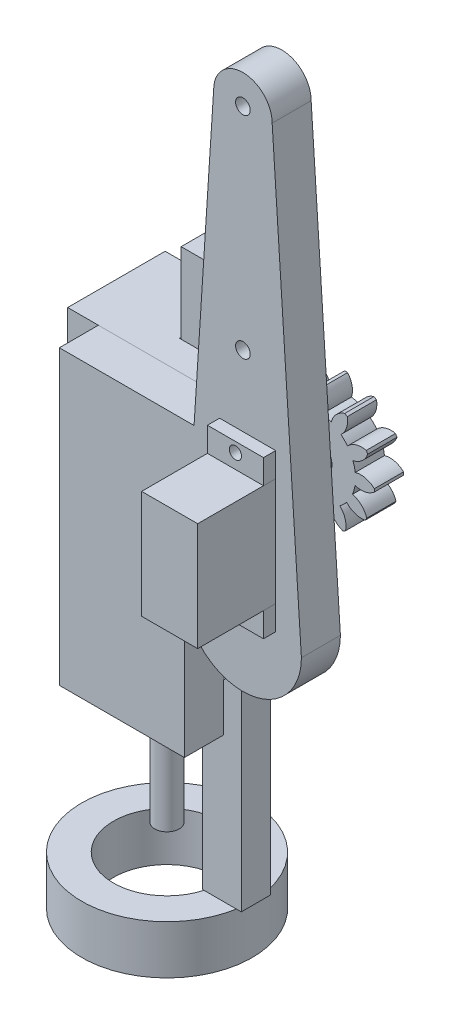
from build123d import *

# Parameters (mm, degrees)
SKETCH2_R                     = 1.5
BOSS_EXTRUDE1_DEPTH           = 8
CUT_EXTRUDE1_DEPTH            = 78.916763231
CUT_EXTRUDE1_DEPTH_BACK       = 10
SKETCH3_R                     = 2.25
CUT_EXTRUDE2_DEPTH            = 78.916763231
CUT_EXTRUDE2_DEPTH_BACK       = 1
SKETCH3_3_R                   = 1.25
SKETCH3_3_W                   = 11.5
SKETCH3_3_H                   = 5
SKETCH4_W                     = 11.5
SKETCH4_H                     = 22.2
BOSS_EXTRUDE3_DEPTH           = 17
SKETCH3_6_R                   = 1.25
BOSS_EXTRUDE4_DEPTH           = 2.5
SKETCH3_6_W                   = 11.5
SKETCH3_6_H                   = 5
BOSS_EXTRUDE4_2_DEPTH         = 2.5
SKETCH3_9_W                   = 11.5
SKETCH3_9_H                   = 22.2
BOSS_EXTRUDE7_DEPTH           = 4
SKETCH3_13_R                  = 2.25
BOSS_EXTRUDE10_DEPTH          = 9
SKETCH3_14_R                  = 2.25
BOSS_EXTRUDE12_DEPTH          = 12
SKETCH9_R                     = 3.3
SKETCH9_R_2                   = 2.3
EXTRUDE_THIN1_DEPTH           = 4
BODY_MOVE_COPY2_START         = -8
BODY_MOVE_COPY2_OUTLINE_R     = 3.3
BODY_MOVE_COPY2_OUTLINE_R_2   = 2.3
BODY_MOVE_COPY2_DEPTH         = 2
BODY_MOVE_COPY2_START_2       = -4
BODY_MOVE_COPY2_2_OUTLINE_R   = 3.3
BODY_MOVE_COPY2_2_OUTLINE_R_2 = 2.3
BODY_MOVE_COPY2_2_DEPTH       = 2
BOSS_EXTRUDE16_DEPTH          = 6
SKETCH26_W                    = 31.957276716
SKETCH26_H                    = 60
BOSS_EXTRUDE19_DEPTH          = 20
SKETCH28_W                    = 15
SKETCH28_H                    = 6
CUT_EXTRUDE5_DEPTH            = 85.244505145
CUT_EXTRUDE_THIN1_DEPTH       = 92.962691604
CUT_EXTRUDE_THIN1_DEPTH_BACK  = 20
SKETCH30_W                    = 31.957276716
SKETCH30_H                    = 10
BOSS_EXTRUDE20_DEPTH          = 6
SKETCH31_R                    = 2.5
BOSS_EXTRUDE21_DEPTH          = 40
BOSS_EXTRUDE22_DEPTH          = 6
SKETCH32_R                    = 17.5
SKETCH32_R_2                  = 11
BOSS_EXTRUDE23_DEPTH          = 10


# Read off the part's stored shape, not the designer's step: Body-Move/Copy2, Boss-Extrude20
with BuildPart() as part:
    # Sketch2 → Boss-Extrude1 (new body)
    with BuildSketch(Plane.XY):
        with BuildLine():
            Line((6, 61.74137931), (12, -30.25862069))
            ThreePointArc((12, -30.25862069), (0, -42.25862069), (-12, -30.25862069))
            Line((-12, -30.25862069), (-12, -60))
            Line((-12, -60), (-37.658033957, -60))
            Line((-37.658033957, -60), (-37.658033957, 0))
            Line((-37.658033957, 0), (-10.026611694, 0))
            Line((-10.026611694, 0), (-6, 61.74137931))
            ThreePointArc((-6, 61.74137931), (0, 67.74137931), (6, 61.74137931))
        make_face()
        with Locations((0, 61.74137931)):
            Circle(SKETCH2_R, mode=Mode.SUBTRACT)
        with Locations((0, 18.44137931)):
            Circle(SKETCH2_R, mode=Mode.SUBTRACT)
    extrude(amount=BOSS_EXTRUDE1_DEPTH)

    # Sketch3 → Cut-Extrude1 (cut, two sides: drawn at the far end of the back side and taken through both)
    # profile 1 of 5: a face of its own
    with BuildSketch(Plane.XY.offset(8).offset(-CUT_EXTRUDE1_DEPTH_BACK)):
        with BuildLine():
            Line((6.718793033, -23.282111217), (6.718793033, -6.832111217))
            ThreePointArc((6.718793033, -6.832111217), (5.674332938, -10.13671319), (2.920395049, -12.240784767))
            ThreePointArc((2.920395049, -12.240784767), (0.968793033, -14.871331018), (-0.982808983, -12.240784767))
            ThreePointArc((-0.982808983, -12.240784767), (-3.736746872, -10.13671319), (-4.781206967, -6.832111217))
            Line((-4.781206967, -6.832111217), (-4.781206967, -23.282111217))
            Line((-4.781206967, -23.282111217), (6.718793033, -23.282111217))
        make_face()
    # profile 2 of 5: a face of its own
    with BuildSketch(Plane.XY.offset(8).offset(-CUT_EXTRUDE1_DEPTH_BACK)):
        with BuildLine():
            ThreePointArc((2.920395049, -12.240784767), (0.968793033, -1.082111217), (-0.982808983, -12.240784767))
            ThreePointArc((-0.982808983, -12.240784767), (0.968793033, -14.871331018), (2.920395049, -12.240784767))
        make_face()
        with Locations((0.968793033, -6.832111217)):
            Circle(SKETCH3_R, mode=Mode.SUBTRACT)
    # profile 3 of 5: a face of its own
    with BuildSketch(Plane.XY.offset(8).offset(-CUT_EXTRUDE1_DEPTH_BACK)):
        with Locations((0.968793033, -6.832111217)):
            Circle(SKETCH3_R)
    # profile 4 of 5: a face of its own
    with BuildSketch(Plane.XY.offset(8).offset(-CUT_EXTRUDE1_DEPTH_BACK)):
        with BuildLine():
            Line((6.718793033, -1.082111217), (0.968793033, -1.082111217))
            ThreePointArc((0.968793033, -1.082111217), (5.034657025, -2.766247225), (6.718793033, -6.832111217))
            Line((6.718793033, -6.832111217), (6.718793033, -1.082111217))
        make_face()
    # profile 5 of 5: a face of its own
    with BuildSketch(Plane.XY.offset(8).offset(-CUT_EXTRUDE1_DEPTH_BACK)):
        with BuildLine():
            ThreePointArc((-4.781206967, -6.832111217), (-3.097070959, -2.766247225), (0.968793033, -1.082111217))
            Line((0.968793033, -1.082111217), (-4.781206967, -1.082111217))
            Line((-4.781206967, -1.082111217), (-4.781206967, -6.832111217))
        make_face()
    extrude(amount=CUT_EXTRUDE1_DEPTH + CUT_EXTRUDE1_DEPTH_BACK, mode=Mode.SUBTRACT)

    # Sketch3<3> → Cut-Extrude2 (cut, two sides: drawn at the far end of the back side and taken through both)
    # profile 1 of 4: a face of its own
    with BuildSketch(Plane.XY.offset(8).offset(-CUT_EXTRUDE2_DEPTH_BACK)):
        Polygon((-4.781206967, -1.082111217), (0.968793033, -1.082111217), (6.718793033, -1.082111217), (6.718793033, 3.917888783), (-4.781206967, 3.917888783), align=None)
        with Locations((0.968793033, 1.917888783)):
            Circle(SKETCH3_3_R, mode=Mode.SUBTRACT)
    # profile 2 of 4: a face of its own
    with BuildSketch(Plane.XY.offset(8).offset(-CUT_EXTRUDE2_DEPTH_BACK)):
        with Locations((0.968793033, 1.917888783)):
            Circle(SKETCH3_3_R)
    # profile 3 of 4: a face of its own
    with BuildSketch(Plane.XY.offset(8).offset(-CUT_EXTRUDE2_DEPTH_BACK)):
        with Locations((0.968793033, -25.782111217)):
            Rectangle(SKETCH3_3_W, SKETCH3_3_H)
        with Locations((0.968793033, -26.282111217)):
            Circle(SKETCH3_3_R, mode=Mode.SUBTRACT)
    # profile 4 of 4: a face of its own
    with BuildSketch(Plane.XY.offset(8).offset(-CUT_EXTRUDE2_DEPTH_BACK)):
        with Locations((0.968793033, -26.282111217)):
            Circle(SKETCH3_3_R)
    extrude(amount=CUT_EXTRUDE2_DEPTH + CUT_EXTRUDE2_DEPTH_BACK, mode=Mode.SUBTRACT)


with BuildPart() as body_2:
    # Sketch4 → Boss-Extrude3 (new body)
    with BuildSketch(Plane.XY.offset(7)):
        with Locations((0.968793033, -12.182111217)):
            Rectangle(SKETCH4_W, SKETCH4_H)
    extrude(amount=BOSS_EXTRUDE3_DEPTH)


with BuildPart() as body_3:
    # Sketch3<6> → Boss-Extrude4 (new body)
    with BuildSketch(Plane.XY.offset(8)):
        Polygon((-4.781206967, -1.082111217), (0.968793033, -1.082111217), (6.718793033, -1.082111217), (6.718793033, 3.917888783), (-4.781206967, 3.917888783), align=None)
        with Locations((0.968793033, 1.917888783)):
            Circle(SKETCH3_6_R, mode=Mode.SUBTRACT)
    extrude(amount=BOSS_EXTRUDE4_DEPTH)


with BuildPart() as body_4:
    # Sketch3<6> → Boss-Extrude4 2 (new body)
    with BuildSketch(Plane.XY.offset(8)):
        with Locations((0.968793033, -25.782111217)):
            Rectangle(SKETCH3_6_W, SKETCH3_6_H)
        with Locations((0.968793033, -26.282111217)):
            Circle(SKETCH3_6_R, mode=Mode.SUBTRACT)
    extrude(amount=BOSS_EXTRUDE4_2_DEPTH)


with BuildPart() as body_5:
    # Sketch3<9> → Boss-Extrude7 (new body)
    with BuildSketch(Plane.XY.offset(8)):
        with Locations((0.968793033, -12.182111217)):
            Rectangle(SKETCH3_9_W, SKETCH3_9_H)
    extrude(amount=-BOSS_EXTRUDE7_DEPTH)


with BuildPart() as body_6:
    # Sketch3<13> → Boss-Extrude10 (new body)
    with BuildSketch(Plane.XY.offset(8)):
        with BuildLine():
            ThreePointArc((2.920395049, -12.240784767), (0.968793033, -1.082111217), (-0.982808983, -12.240784767))
            ThreePointArc((-0.982808983, -12.240784767), (0.968793033, -14.871331018), (2.920395049, -12.240784767))
        make_face()
        with Locations((0.968793033, -6.832111217)):
            Circle(SKETCH3_13_R, mode=Mode.SUBTRACT)
    extrude(amount=-BOSS_EXTRUDE10_DEPTH)


with BuildPart() as body_7:
    # Sketch3<14> → Boss-Extrude12 (new body)
    with BuildSketch(Plane.XY.offset(8)):
        with Locations((0.968793033, -6.832111217)):
            Circle(SKETCH3_14_R)
    extrude(amount=-BOSS_EXTRUDE12_DEPTH)


with BuildPart() as body_8:
    # Sketch9 → Extrude-Thin1 (new body)
    with BuildSketch(Plane(origin=(0, 0, -4), x_dir=(-1, 0, 0), z_dir=(0, 0, -1))):
        with Locations((-0.968793033, -6.832111217)):
            Circle(SKETCH9_R)
        with Locations((-0.968793033, -6.832111217)):
            Circle(SKETCH9_R_2, mode=Mode.SUBTRACT)
    extrude(amount=EXTRUDE_THIN1_DEPTH)

    # Body-Move/Copy2 outline → Body-Move/Copy2 (cut)
    with BuildSketch(Plane.XY.offset(BODY_MOVE_COPY2_START)):
        with Locations((0.968793033, -6.832111217)):
            Circle(BODY_MOVE_COPY2_OUTLINE_R)
        with Locations((0.968793033, -6.832111217)):
            Circle(BODY_MOVE_COPY2_OUTLINE_R_2, mode=Mode.SUBTRACT)
    extrude(amount=BODY_MOVE_COPY2_DEPTH, mode=Mode.SUBTRACT)

    # Body-Move_Copy2 2 outline → Body-Move_Copy2 2 (add)
    with BuildSketch(Plane.XY.offset(BODY_MOVE_COPY2_START_2)):
        with Locations((0.968793033, -6.832111217)):
            Circle(BODY_MOVE_COPY2_2_OUTLINE_R)
        with Locations((0.968793033, -6.832111217)):
            Circle(BODY_MOVE_COPY2_2_OUTLINE_R_2, mode=Mode.SUBTRACT)
    extrude(amount=BODY_MOVE_COPY2_2_DEPTH)

    # Sketch20 → Boss-Extrude16 (add)
    with BuildSketch(Plane(origin=(0, 0, -6), x_dir=(-1, 0, 0), z_dir=(0, 0, -1))):
        with BuildLine():
            ThreePointArc((-11.608830214, -1.282624278), (-10.444163041, -3.009989163), (-8.582644253, -3.945396491))
            ThreePointArc((-8.582644253, -3.945396491), (-8.869637263, -4.862209504), (-9.046655113, -5.806442404))
            ThreePointArc((-9.046655113, -5.806442404), (-11.129425787, -5.758427918), (-12.968714556, -6.736822467))
            ThreePointArc((-12.968714556, -6.736822467), (-12.967265179, -7.041545327), (-12.958078998, -7.34613314))
            ThreePointArc((-12.958078998, -7.34613314), (-11.085765197, -8.259741426), (-9.005938973, -8.139068541))
            ThreePointArc((-9.005938973, -8.139068541), (-8.796075704, -9.076548406), (-8.47726121, -9.982787009))
            ThreePointArc((-8.47726121, -9.982787009), (-10.305000766, -10.982590581), (-11.40867429, -12.7495495))
            ThreePointArc((-11.40867429, -12.7495495), (-11.255057663, -13.01272255), (-11.09480829, -13.271910243))
            ThreePointArc((-11.09480829, -13.271910243), (-9.016532832, -13.126961327), (-7.275686929, -11.982542431))
            ThreePointArc((-7.275686929, -11.982542431), (-6.625200074, -12.689492175), (-5.895979321, -13.31491058))
            ThreePointArc((-5.895979321, -13.31491058), (-6.978946422, -15.094635651), (-7.051276272, -17.176703724))
            ThreePointArc((-7.051276272, -17.176703724), (-6.786653846, -17.327809957), (-6.518279972, -17.472148397))
            ThreePointArc((-6.518279972, -17.472148397), (-4.790915087, -16.307481225), (-3.855507758, -14.445962437))
            ThreePointArc((-3.855507758, -14.445962437), (-2.938694746, -14.732955447), (-1.994461846, -14.909973297))
            ThreePointArc((-1.994461846, -14.909973297), (-2.042476332, -16.99274397), (-1.064081783, -18.832032739))
            ThreePointArc((-1.064081783, -18.832032739), (-0.759358923, -18.830583363), (-0.454771109, -18.821397182))
            ThreePointArc((-0.454771109, -18.821397182), (0.458837176, -16.949083381), (0.338164291, -14.869257156))
            ThreePointArc((0.338164291, -14.869257156), (1.275644156, -14.659393887), (2.181882759, -14.340579393))
            ThreePointArc((2.181882759, -14.340579393), (3.181686332, -16.168318949), (4.94864525, -17.271992473))
            ThreePointArc((4.94864525, -17.271992473), (5.2118183, -17.118375847), (5.471005993, -16.958126474))
            ThreePointArc((5.471005993, -16.958126474), (5.326057077, -14.879851016), (4.181638181, -13.139005112))
            ThreePointArc((4.181638181, -13.139005112), (4.888587925, -12.488518258), (5.51400633, -11.759297505))
            ThreePointArc((5.51400633, -11.759297505), (7.293731401, -12.842264606), (9.375799474, -12.914594456))
            ThreePointArc((9.375799474, -12.914594456), (9.526905707, -12.64997203), (9.671244148, -12.381598155))
            ThreePointArc((9.671244148, -12.381598155), (8.506576975, -10.654233271), (6.645058187, -9.718825942))
            ThreePointArc((6.645058187, -9.718825942), (6.932051197, -8.802012929), (7.109069047, -7.85778003))
            ThreePointArc((7.109069047, -7.85778003), (9.191839721, -7.905794515), (11.031128489, -6.927399966))
            ThreePointArc((11.031128489, -6.927399966), (11.029679113, -6.622677106), (11.020492932, -6.318089293))
            ThreePointArc((11.020492932, -6.318089293), (9.148179131, -5.404481008), (7.068352907, -5.525153892))
            ThreePointArc((7.068352907, -5.525153892), (6.858489638, -4.587674028), (6.539675143, -3.681435424))
            ThreePointArc((6.539675143, -3.681435424), (8.367414699, -2.681631852), (9.471088223, -0.914672933))
            ThreePointArc((9.471088223, -0.914672933), (9.317471597, -0.651499884), (9.157222224, -0.39231219))
            ThreePointArc((9.157222224, -0.39231219), (7.078946766, -0.537261107), (5.338100862, -1.681680002))
            ThreePointArc((5.338100862, -1.681680002), (4.687614008, -0.974730258), (3.958393255, -0.349311853))
            ThreePointArc((3.958393255, -0.349311853), (5.041360356, 1.430413217), (5.113690206, 3.51248129))
            ThreePointArc((5.113690206, 3.51248129), (4.84906778, 3.663587524), (4.580693905, 3.807925964))
            ThreePointArc((4.580693905, 3.807925964), (2.853329021, 2.643258791), (1.917921692, 0.781740003))
            ThreePointArc((1.917921692, 0.781740003), (1.00110868, 1.068733013), (0.05687578, 1.245750864))
            ThreePointArc((0.05687578, 1.245750864), (0.104890265, 3.328521537), (-0.873504284, 5.167810306))
            ThreePointArc((-0.873504284, 5.167810306), (-1.178227143, 5.16636093), (-1.482814957, 5.157174748))
            ThreePointArc((-1.482814957, 5.157174748), (-2.396423242, 3.284860947), (-2.275750358, 1.205034723))
            ThreePointArc((-2.275750358, 1.205034723), (-3.213230222, 0.995171454), (-4.119468825, 0.67635696))
            ThreePointArc((-4.119468825, 0.67635696), (-5.119272398, 2.504096516), (-6.886231317, 3.60777004))
            ThreePointArc((-6.886231317, 3.60777004), (-7.149404366, 3.454153413), (-7.40859206, 3.29390404))
            ThreePointArc((-7.40859206, 3.29390404), (-7.263643143, 1.215628582), (-6.119224248, -0.525217321))
            ThreePointArc((-6.119224248, -0.525217321), (-6.826173991, -1.175704176), (-7.451592396, -1.904924928))
            ThreePointArc((-7.451592396, -1.904924928), (-9.231317467, -0.821957828), (-11.31338554, -0.749627978))
            ThreePointArc((-11.31338554, -0.749627978), (-11.464491773, -1.014250404), (-11.608830214, -1.282624278))
        make_face()
    extrude(amount=BOSS_EXTRUDE16_DEPTH)


with BuildPart() as body_9:
    # Sketch26 → Boss-Extrude19 (new body)
    with BuildSketch(Plane(origin=(0, 0, 0), x_dir=(-1, 0, 0), z_dir=(0, 0, -1))):
        with Locations((27.978638358, -30)):
            Rectangle(SKETCH26_W, SKETCH26_H)
    extrude(amount=BOSS_EXTRUDE19_DEPTH)

    # Sketch28 → Cut-Extrude5 (cut, through all)
    with BuildSketch(Plane(origin=(0, 0, 0), x_dir=(1, 0, 0), z_dir=(0, 1, 0))):
        with Locations((-19.5, 9)):
            Rectangle(SKETCH28_W, SKETCH28_H)
    extrude(amount=-CUT_EXTRUDE5_DEPTH, mode=Mode.SUBTRACT)

    # Sketch30 → Cut-Extrude-Thin1 (cut, two sides: drawn at the far end of the back side and taken through both)
    with BuildSketch(Plane(origin=(0, 0, -20), x_dir=(-1, 0, 0), z_dir=(0, 0, -1)).offset(-CUT_EXTRUDE_THIN1_DEPTH_BACK)):
        with Locations((27.978638358, -55.222248526)):
            Rectangle(SKETCH30_W, SKETCH30_H)
    extrude(amount=CUT_EXTRUDE_THIN1_DEPTH + CUT_EXTRUDE_THIN1_DEPTH_BACK, mode=Mode.SUBTRACT)


with BuildPart() as body_10:
    # Boss-Extrude20 outline → Boss-Extrude20 (new body)
    with BuildSketch(Plane(origin=(0, 0, -6), x_dir=(-1, 0, 0), z_dir=(0, 0, -1))):
        Polygon((13.174426709, -55.582797385), (14.33357684, -55.582797385), (14.33357684, -95.582797385), (22.33357684, -95.582797385), (22.33357684, -60), (26.674426709, -60), (26.674426709, 16.457265735), (13.174426709, 16.457265735), (13.174426709, 8.880955175), (8.071228846, 7.223200766), (8.071228846, 5.855664244), (13.174426709, 4.197909835), (13.174426709, 3.580955175), (8.071228846, 1.923200766), (8.071228846, 0.555664244), (12, -0.720582117), (12, 0), (13.174426709, 0), (13.174426709, -1.719044825), (8.071228846, -3.376799234), (8.071228846, -4.744335756), (13.174426709, -6.402090165), (13.174426709, -7.019044825), (8.071228846, -8.676799234), (8.071228846, -10.044335756), (13.174426709, -11.702090165), (13.174426709, -12.319044825), (8.071228846, -13.976799234), (8.071228846, -15.344335756), (13.174426709, -17.002090165), (13.174426709, -17.619044825), (8.071228846, -19.276799234), (8.071228846, -20.644335756), (13.174426709, -22.302090165), (13.174426709, -22.919044825), (8.071228846, -24.576799234), (8.071228846, -25.944335756), (13.174426709, -27.602090165), (13.174426709, -28.219044825), (8.071228846, -29.876799234), (8.071228846, -31.244335756), (13.174426709, -32.902090165), (13.174426709, -33.519044825), (8.071228846, -35.176799234), (8.071228846, -36.544335756), (13.174426709, -38.202090165), (13.174426709, -38.819044825), (8.071228846, -40.476799234), (8.071228846, -41.844335756), (13.174426709, -43.502090165), align=None)
    extrude(amount=BOSS_EXTRUDE20_DEPTH)

    # Sketch29<4> → Boss-Extrude22 (add)
    with BuildSketch(Plane(origin=(0, 0, -6), x_dir=(-1, 0, 0), z_dir=(0, 0, -1))):
        Polygon((13.174426709, 9.500955175), (13.174426709, 14.184000515), (8.071228846, 12.526246106), (8.071228846, 11.158709584), align=None)
    extrude(amount=BOSS_EXTRUDE22_DEPTH)


with BuildPart() as body_11:
    # Sketch31 → Boss-Extrude21 (new body)
    with BuildSketch(Plane(origin=(0, -50.222248526, 0), x_dir=(-1, 0, 0), z_dir=(0, -1, 0))):
        with Locations(Location((32.575536538, 9, 0), (0, 0, 90))):
            Circle(SKETCH31_R)
    extrude(amount=BOSS_EXTRUDE21_DEPTH)


with BuildPart() as body_12:
    # Sketch32 → Boss-Extrude23 (new body)
    with BuildSketch(Plane(origin=(0, -95.582797385, 0), x_dir=(-1, 0, 0), z_dir=(0, -1, 0))):
        with Locations(Location((32.575536538, 9, 0), (0, 0, 90))):
            Circle(SKETCH32_R)
        with Locations(Location((32.575536538, 9, 0), (0, 0, 90))):
            Circle(SKETCH32_R_2, mode=Mode.SUBTRACT)
    extrude(amount=BOSS_EXTRUDE23_DEPTH)


solid = Compound([part.part, body_2.part, body_3.part, body_4.part, body_5.part, body_6.part, body_7.part, body_8.part, body_9.part, body_10.part, body_11.part, body_12.part])
